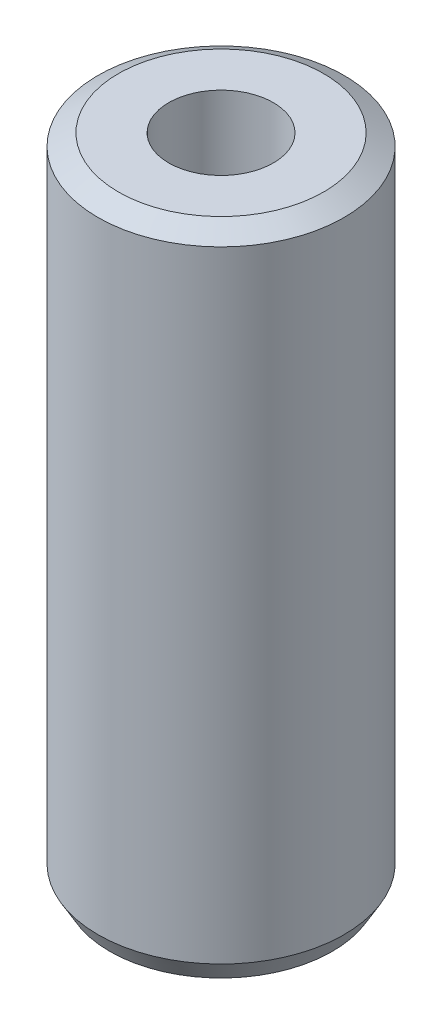
from build123d import *
from OCP.BRepFilletAPI import BRepFilletAPI_MakeChamfer

# Parameters (mm, degrees)
SKETCH1_R           = 32.5
BOSS_EXTRUDE1_DEPTH = 172.520171998
SKETCH2_R           = 13.81394174
CUT_EXTRUDE1_DEPTH  = 179.537698389
CHAMFER1_SIZE       = 3.119978491
CHAMFER1_SIZE2      = 5.403961265


with BuildPart() as part:
    # Sketch1 → Boss-Extrude1 (new body)
    with BuildSketch(Plane(origin=(0, 0, 0), x_dir=(1, 0, 0), z_dir=(0, 1, 0))):
        Circle(SKETCH1_R)
    extrude(amount=BOSS_EXTRUDE1_DEPTH)

    # Sketch2 → Cut-Extrude1 (cut, through all)
    with BuildSketch(Plane(origin=(0, 0, 0), x_dir=(1, 0, 0), z_dir=(0, 1, 0))):
        Circle(SKETCH2_R)
    extrude(amount=CUT_EXTRUDE1_DEPTH, mode=Mode.SUBTRACT)

    # Chamfer1: one chamfer whose edges measure the first distance from different faces: ONE call of the kernel's chamfer builder (chamfer() names one face for all edges)
    chamfer1_edges_1 = [part.edges().sort_by_distance(p)[0] for p in [
        (-32.5, 172.520171998, 0),
    ]]
    chamfer1_side_1 = [part.faces().sort_by_distance(p)[0] for p in [
        (-32.5, 86.260085999, 0),
    ]]
    chamfer1_edges_2 = [part.edges().sort_by_distance(p)[0] for p in [
        (-32.5, 0, 0),
    ]]
    chamfer1_side_2 = [part.faces().sort_by_distance(p)[0] for p in [
        (-31.580761184, 0, 0),
    ]]
    chamfer1 = BRepFilletAPI_MakeChamfer(part.part.solid().wrapped)
    for e in chamfer1_edges_1:
        chamfer1.Add(CHAMFER1_SIZE, CHAMFER1_SIZE2, e.wrapped, chamfer1_side_1[0].wrapped)  # the first distance lies on this face
    for e in chamfer1_edges_2:
        chamfer1.Add(CHAMFER1_SIZE, CHAMFER1_SIZE2, e.wrapped, chamfer1_side_2[0].wrapped)  # the first distance lies on this face
    add(Compound.cast(chamfer1.Shape()), mode=Mode.REPLACE)


solid = part.part
